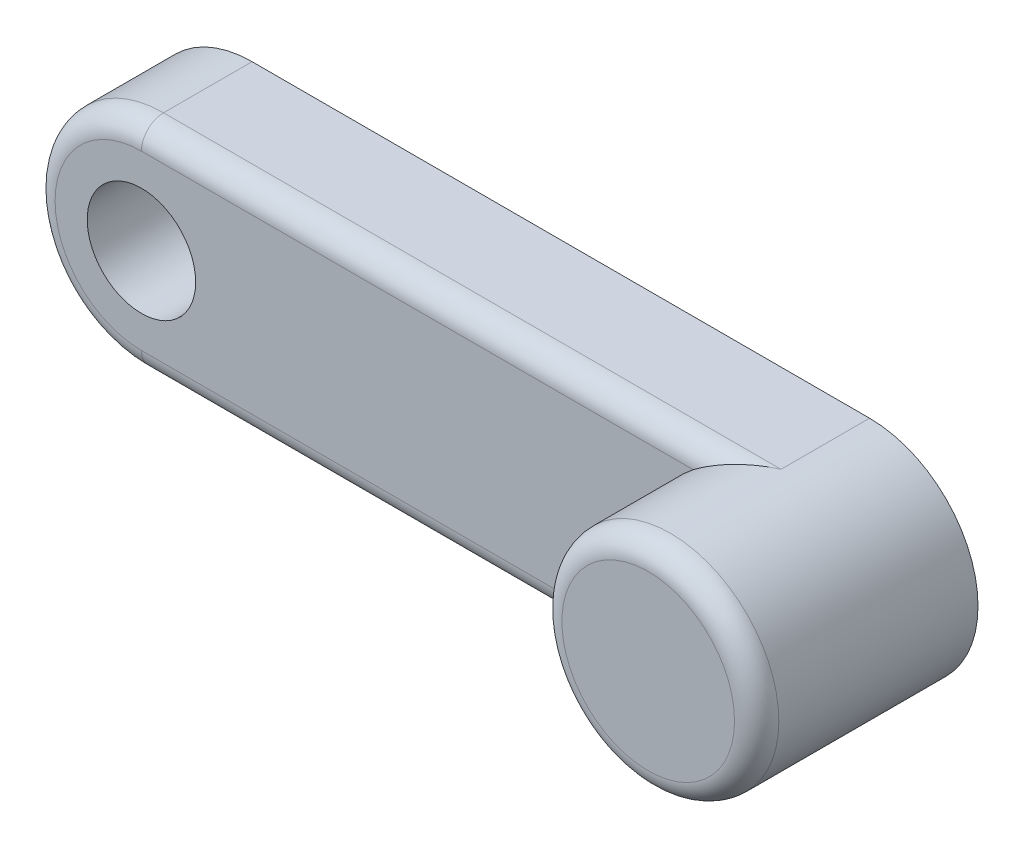
from build123d import *

# Parameters (mm, degrees)
SKETCH1_R           = 2.45
BOSS_EXTRUDE1_DEPTH = 5
BOSS_EXTRUDE2_START = 5
SKETCH2_R           = 4.9
BOSS_EXTRUDE2_DEPTH = 5
FILLET1_R           = 1


with BuildPart() as part:
    # Sketch1 → Boss-Extrude1 (new body)
    with BuildSketch(Plane.XY):
        with BuildLine():
            Line((0, 4.9), (27.899102923, 4.9))
            ThreePointArc((27.899102923, 4.9), (32.799102923, 0), (27.899102923, -4.9))
            Line((27.899102923, -4.9), (0, -4.9))
            ThreePointArc((0, -4.9), (-4.9, 0), (0, 4.9))
        make_face()
        Circle(SKETCH1_R, mode=Mode.SUBTRACT)
    extrude(amount=BOSS_EXTRUDE1_DEPTH)

    # Sketch2 → Boss-Extrude2 (add)
    with BuildSketch(Plane.XY.offset(BOSS_EXTRUDE2_START)):
        with Locations(Location((27.899102923, 0, 0), (0, 0, 90))):
            Circle(SKETCH2_R)
    extrude(amount=BOSS_EXTRUDE2_DEPTH)

    # Fillet1
    # the kernel refuses this fillet: 1 mm, written as the material it takes off along each edge
    with BuildSketch(Plane(origin=(0, 4.9, 5), x_dir=(0, -1, 0), z_dir=(1, 0, 0))) as fillet1_piece_1_section:
        with BuildLine():
            CenterArc((FILLET1_R, FILLET1_R), FILLET1_R, 180, 90)
            Line((0, FILLET1_R), (0, 0))
            Line((0, 0), (FILLET1_R, 0))
        make_face()
    fillet1_piece_1 = extrude(amount=30.399102923, mode=Mode.PRIVATE)
    fillet1_piece_1 = fillet1_piece_1 - Plane(origin=(27.899102923, 0, 4.766386188), x_dir=(0, 1, 0), z_dir=(0, 0, -1)) * Cylinder(4.9, 65, mode=Mode.PRIVATE)
    add(fillet1_piece_1, mode=Mode.SUBTRACT)
    with BuildSketch(Plane(origin=(27.899102923, 0, 10), x_dir=(0, 1, 0), z_dir=(1, 0, 0))) as fillet1_piece_2:
        with BuildLine():
            CenterArc((4.9 - FILLET1_R, -FILLET1_R), FILLET1_R, 0, 90)
            Line((4.9 - FILLET1_R, 0), (4.9, 0))
            Line((4.9, 0), (4.9, -FILLET1_R))
        make_face()
    revolve(axis=Axis((27.899102923, 0, 10), (0, 0, 1)), mode=Mode.SUBTRACT)
    with BuildSketch(Plane(origin=(0, 0, 5), x_dir=(0, -1, 0), z_dir=(1, 0, 0))) as fillet1_piece_3:
        with BuildLine():
            CenterArc((4.9 - FILLET1_R, FILLET1_R), FILLET1_R, 270, 90)
            Line((4.9 - FILLET1_R, 0), (4.9, 0))
            Line((4.9, 0), (4.9, FILLET1_R))
        make_face()
    revolve(axis=Axis((0, 0, 5), (0, 0, -1)), revolution_arc=180, mode=Mode.SUBTRACT)
    with BuildSketch(Plane(origin=(30.399102923, -4.9, 5), x_dir=(0, 0, -1), z_dir=(-1, 0, 0))) as fillet1_piece_4_section:
        with BuildLine():
            CenterArc((FILLET1_R, -FILLET1_R), FILLET1_R, 90, 90)
            Line((0, -FILLET1_R), (0, 0))
            Line((0, 0), (FILLET1_R, 0))
        make_face()
    fillet1_piece_4 = extrude(amount=30.399102923, mode=Mode.PRIVATE)
    fillet1_piece_4 = fillet1_piece_4 - Plane(origin=(27.899102923, 0, 4.766386187), x_dir=(0, 1, 0), z_dir=(0, 0, -1)) * Cylinder(4.9, 65, mode=Mode.PRIVATE)
    add(fillet1_piece_4, mode=Mode.SUBTRACT)


solid = part.part
